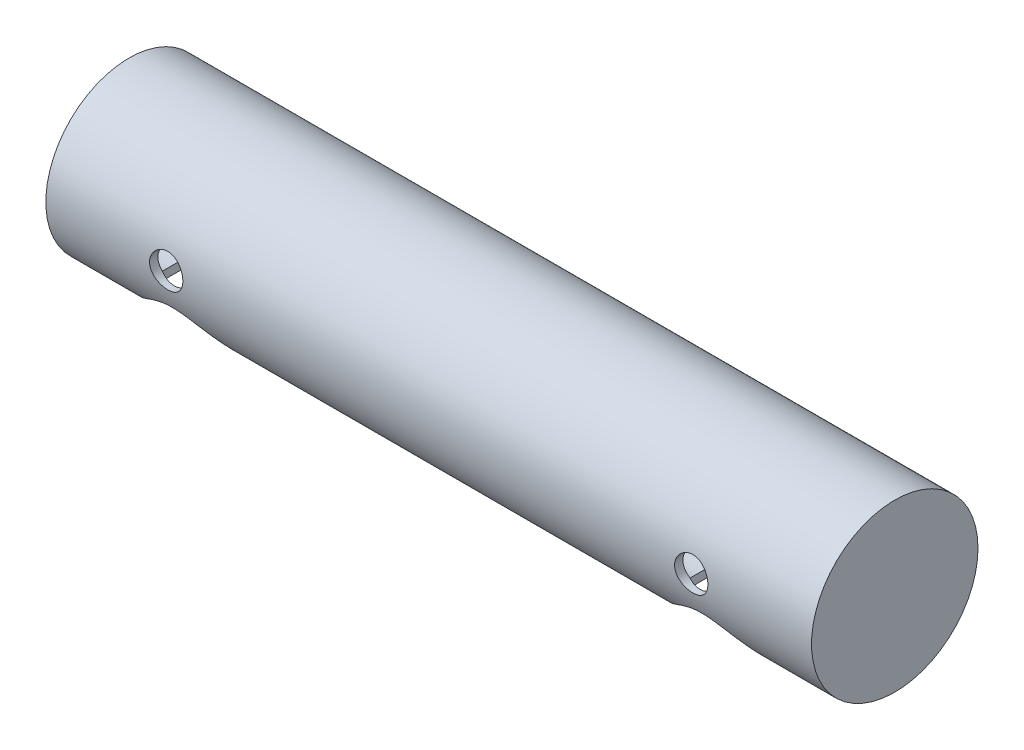
from build123d import *

# Parameters (mm, degrees)
BOSS_EXTRUDE1_DEPTH      = 420
BOSS_EXTRUDE1_DEPTH_BACK = 40
SKETCH1_R                = 50
SHELL12_T                = 5
SKETCH2_R                = 45
CUT_EXTRUDE2_DEPTH       = 50
SKETCH4_R                = 10
CUT_EXTRUDE3_DEPTH       = 50


with BuildPart() as part:
    # Sketch1 → Boss-Extrude1 (new, two sides: drawn at the far end of the back side and taken through both)
    with BuildSketch(Plane(origin=(0, 0, 0), x_dir=(0, 0, -1), z_dir=(1, 0, 0)).offset(-BOSS_EXTRUDE1_DEPTH_BACK)):
        Circle(SKETCH1_R)
    extrude(amount=BOSS_EXTRUDE1_DEPTH + BOSS_EXTRUDE1_DEPTH_BACK)

    # Shell12 (no face opened: a closed hollow body)
    add(offset(amount=-SHELL12_T, mode=Mode.PRIVATE), mode=Mode.SUBTRACT)

    # Sketch2 → Cut-Extrude2 (cut)
    with BuildSketch(Plane(origin=(0, 0, 0), x_dir=(1, 0, 0), z_dir=(0, 1, 0))):
        with Locations((349.077931711, 0)):
            Circle(SKETCH2_R)
    cut_extrude2 = extrude(amount=-CUT_EXTRUDE2_DEPTH, mode=Mode.SUBTRACT)

    # Sketch4 → Cut-Extrude3 (cut, symmetric)
    with BuildSketch(Plane.XY):
        with Locations((347.706393578, 0)):
            Circle(SKETCH4_R)
    cut_extrude3 = extrude(amount=CUT_EXTRUDE3_DEPTH, both=True, mode=Mode.SUBTRACT)

    # Mirror1: Cut-Extrude2, Cut-Extrude3 across plane
    add(cut_extrude2.mirror(Plane(origin=(190, 0, 0), x_dir=(0, 0, 1), z_dir=(1, 0, 0))), mode=Mode.SUBTRACT)
    add(cut_extrude3.mirror(Plane(origin=(190, 0, 0), x_dir=(0, 0, 1), z_dir=(1, 0, 0))), mode=Mode.SUBTRACT)


solid = part.part
